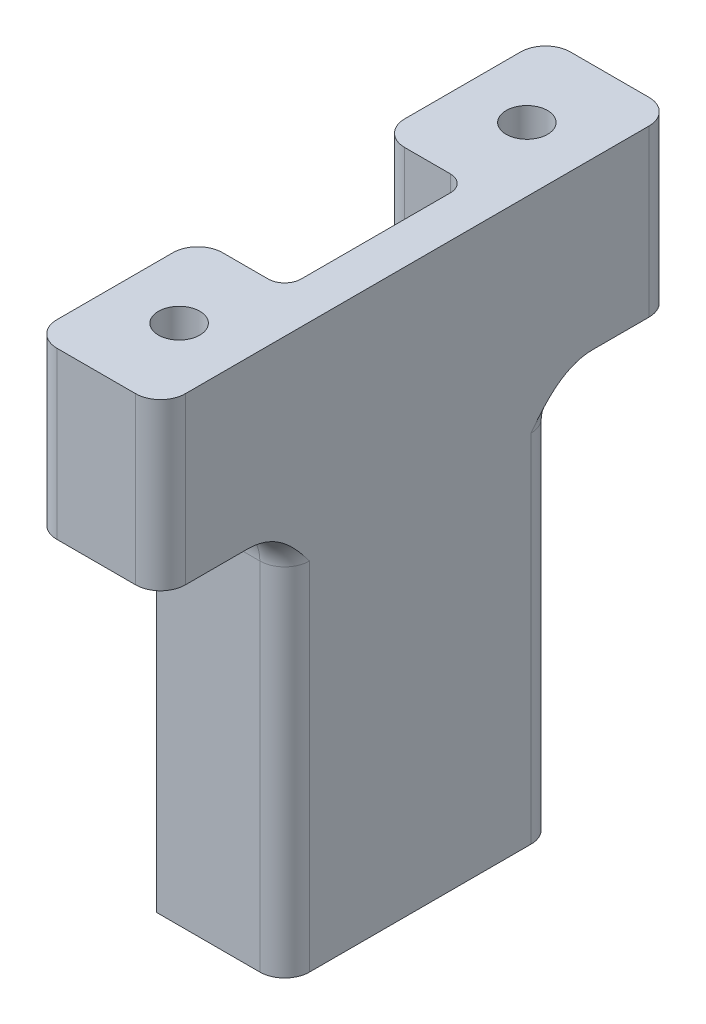
from build123d import *

# Parameters (mm, degrees)
SKETCH1_W             = 15.5
SKETCH1_H             = 62
BOSS_EXTRUDE1_DEPTH   = 68
FILLET1_R             = 3
CUT_EXTRUDE1_REACH    = 77.327
CUT_EXTRUDE2_DEPTH    = 48
FILLET2_R             = 5
M6_TAPPED_HOLE1_D     = 5
M6_TAPPED_HOLE1_DEPTH = 15
M6_TAPPED_HOLE1_TIP   = 1.502151548


with BuildPart() as part:
    # Sketch1 → Boss-Extrude1 (new body)
    with BuildSketch(Plane(origin=(0, 0, 0), x_dir=(1, 0, 0), z_dir=(0, 1, 0))):
        with Locations((-0.38, -0.37)):
            Rectangle(SKETCH1_W, SKETCH1_H)
    extrude(amount=-BOSS_EXTRUDE1_DEPTH)

    # Fillet1
    fillet1_edges = [part.edges().sort_by_distance(p)[0] for p in [
        (7.37, -34, 31.37),
        (-8.13, -34, 31.37),
        (-8.13, -34, -30.63),
        (7.37, -34, -30.63),
    ]]
    fillet(fillet1_edges, radius=FILLET1_R)

    # Sketch2 → Cut-Extrude1 (cut, up to next)
    with BuildSketch(Plane(origin=(0, 0, 0), x_dir=(1, 0, 0), z_dir=(0, 1, 0)), mode=Mode.PRIVATE) as cut_extrude1_sk1:
        with BuildLine():
            Line((-5.13, 10.63), (0.37, 10.63))
            ThreePointArc((0.37, 10.63), (1.784213562, 10.044213562), (2.37, 8.63))
            Line((2.37, 8.63), (2.37, -9.37))
            ThreePointArc((2.37, -9.37), (1.784213562, -10.784213562), (0.37, -11.37))
            Line((0.37, -11.37), (-5.13, -11.37))
            ThreePointArc((-5.13, -11.37), (-7.251320344, -12.248679656), (-8.13, -14.37))
            Line((-8.13, -14.37), (-8.13, 13.63))
            ThreePointArc((-8.13, 13.63), (-7.251320344, 11.508679656), (-5.13, 10.63))
        make_face()
    cut_extrude1_tool1 = extrude(cut_extrude1_sk1.sketch, amount=-CUT_EXTRUDE1_REACH, mode=Mode.PRIVATE) & part.part
    add(cut_extrude1_tool1.solids().sort_by_distance((-2.991251, 0, 0.37))[0], mode=Mode.SUBTRACT)

    # Sketch3 → Cut-Extrude2 (cut)
    with BuildSketch(Plane(origin=(0, -68, 0), x_dir=(1, 0, 0), z_dir=(0, 1, 0))):
        with BuildLine():
            Line((4.37, -16.37), (-8.13, -16.37))
            Line((-8.13, -16.37), (-8.13, -28.37))
            ThreePointArc((-8.13, -28.37), (-7.251320344, -30.491320344), (-5.13, -31.37))
            Line((-5.13, -31.37), (4.37, -31.37))
            ThreePointArc((4.37, -31.37), (6.491320344, -30.491320344), (7.37, -28.37))
            Line((7.37, -28.37), (7.37, -13.37))
            ThreePointArc((7.37, -13.37), (6.491320344, -15.491320344), (4.37, -16.37))
        make_face()
    cut_extrude2 = extrude(amount=CUT_EXTRUDE2_DEPTH, mode=Mode.SUBTRACT)

    # Mirror1: Cut-Extrude2 across plane
    add(cut_extrude2.mirror(Plane.XY), mode=Mode.SUBTRACT)

    # Fillet2
    # the kernel refuses this fillet: 5 mm, written as the material it adds along each edge
    with BuildSketch(Plane(origin=(4.37, -20, -16.37), x_dir=(0, -1, 0), z_dir=(-1, 0, 0)), Plane(origin=(4.37, -20, 16.37), x_dir=(0, 0, 1), z_dir=(-1, 0, 0))) as fillet2_piece_1:
        with BuildLine():
            CenterArc((FILLET2_R, -FILLET2_R), FILLET2_R, 90, 90)
            Line((0, -FILLET2_R), (0, 0))
            Line((0, 0), (FILLET2_R, 0))
        make_face()
    extrude(amount=12.5)
    with BuildSketch(Plane(origin=(4.37, -20, -13.37), x_dir=(-0.5176042277799098, 0, -0.855620163030514), z_dir=(0.855620163030514, 0, -0.5176042277799098))) as fillet2_piece_2_section:
        with BuildLine():
            CenterArc((-3 - FILLET2_R, -FILLET2_R), FILLET2_R, 0, 90)
            Line((-3, -FILLET2_R), (-3, 0))
            Line((-3, 0), (-3 - FILLET2_R, 0))
        make_face()
    fillet2_piece_2 = revolve(axis=Axis((4.37, -20, -13.37), (0, 1, 0)), revolution_arc=328.828315396, mode=Mode.PRIVATE)
    fillet2_piece_2 = split(fillet2_piece_2, bisect_by=Plane(origin=(6.644254363, -21.721658314, -10.63), z_dir=(0, 0, -1)), keep=Keep.TOP, mode=Mode.PRIVATE)
    fillet2_piece_2 = split(fillet2_piece_2, bisect_by=Plane(origin=(7.37, -21.721658314, -15.644254458), z_dir=(-1, 0, 0)), keep=Keep.TOP, mode=Mode.PRIVATE)
    add(fillet2_piece_2)
    with BuildSketch(Plane(origin=(4.37, -20, 13.37), x_dir=(-0.5176042277799098, 0, 0.855620163030514), z_dir=(0.855620163030514, 0, 0.5176042277799098))) as fillet2_piece_3_section:
        with BuildLine():
            CenterArc((-3 - FILLET2_R, FILLET2_R), FILLET2_R, 270, 90)
            Line((-3, FILLET2_R), (-3, 0))
            Line((-3, 0), (-3 - FILLET2_R, 0))
        make_face()
    fillet2_piece_3 = revolve(axis=Axis((4.37, -20, 13.37), (0, -1, 0)), revolution_arc=328.828315396, mode=Mode.PRIVATE)
    fillet2_piece_3 = split(fillet2_piece_3, bisect_by=Plane(origin=(6.644254403, -21.721658525, 11.37), z_dir=(0, 0, 1)), keep=Keep.TOP, mode=Mode.PRIVATE)
    fillet2_piece_3 = split(fillet2_piece_3, bisect_by=Plane(origin=(7.37, -21.721658525, 15.644254403), z_dir=(-1, 0, 0)), keep=Keep.TOP, mode=Mode.PRIVATE)
    add(fillet2_piece_3)

    # M6 Tapped Hole1
    with Locations(Plane(origin=(0, 0, 0), x_dir=(1, 0, 0), z_dir=(0, 1, 0))):
        with Locations((-0.38, 20.63), (-0.38, -21.37)):
            Hole(M6_TAPPED_HOLE1_D / 2, depth=M6_TAPPED_HOLE1_DEPTH)
            with Locations((0, 0, -(M6_TAPPED_HOLE1_DEPTH + M6_TAPPED_HOLE1_TIP / 2))):  # 118° drill point
                Cone(0, M6_TAPPED_HOLE1_D / 2, M6_TAPPED_HOLE1_TIP, mode=Mode.SUBTRACT)


solid = part.part
